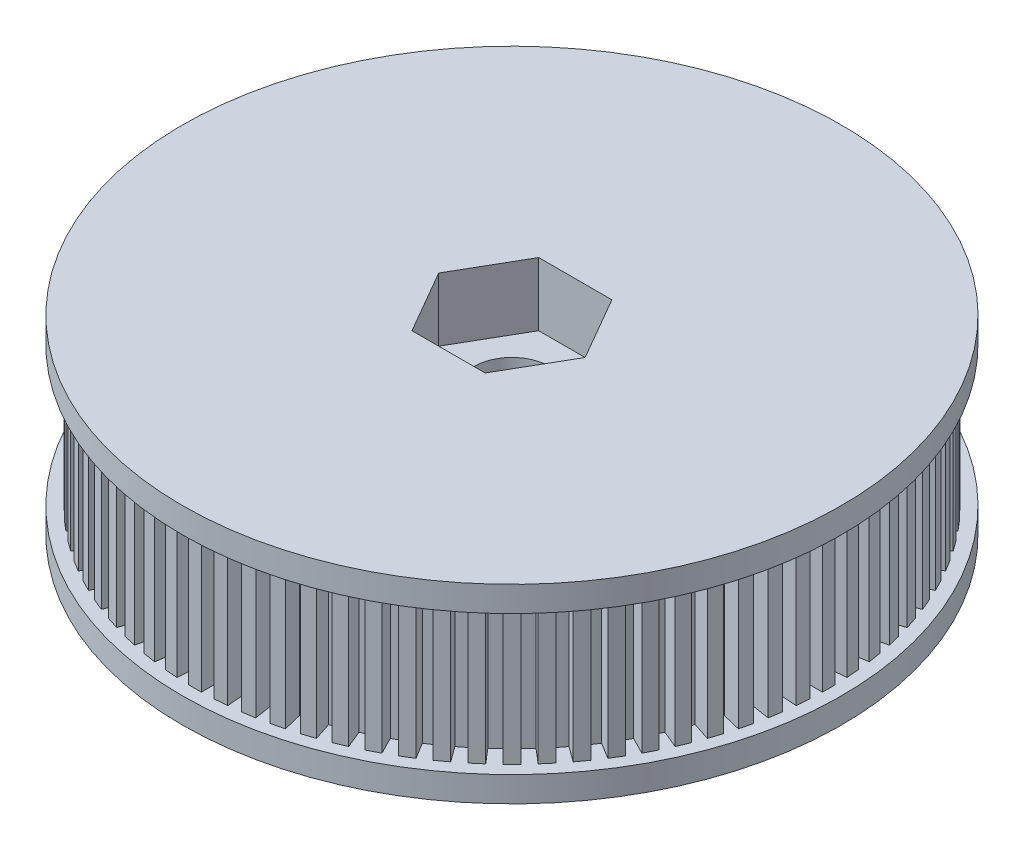
from build123d import *

# Parameters (mm, degrees)
BOSS_EXTRUDE1_OUTLINE_R = 3
BOSS_EXTRUDE1_DEPTH     = 15
SKETCH1_3_R             = 26
SKETCH1_3_R_2           = 23.505318547
SKETCH1_3_R_3           = 3
BOSS_EXTRUDE2_DEPTH     = 2
BOSS_EXTRUDE3_START     = 13
SKETCH1_4_R             = 26
SKETCH1_4_R_2           = 23.505318547
SKETCH1_4_R_3           = 3
BOSS_EXTRUDE3_DEPTH     = 2
CUT_EXTRUDE1_START      = 10
SKETCH1_5_R             = 3
CUT_EXTRUDE1_DEPTH      = 5


with BuildPart() as part:
    # Boss-Extrude1: read off the stored shape, not the designer's step
    # Boss-Extrude1 outline → Boss-Extrude1 (new body)
    with BuildSketch(Plane(origin=(0, 0, 0), x_dir=(1, 0, 0), z_dir=(0, 1, 0))):
        with BuildLine():
            Line((-1.463018726, 24.962162891), (-2.45993606, 24.883703795))
            Line((-2.45993606, 24.883703795), (-2.342247416, 23.388327795))
            ThreePointArc((-2.342247416, 23.388327795), (-2.762753968, 23.34239042), (-3.182365758, 23.288893237))
            Line((-3.182365758, 23.288893237), (-3.417017456, 24.770425747))
            Line((-3.417017456, 24.770425747), (-4.404705796, 24.613991282))
            Line((-4.404705796, 24.613991282), (-4.170054099, 23.132458771))
            ThreePointArc((-4.170054099, 23.132458771), (-4.585660164, 23.053670442), (-4.99978109, 22.967415811))
            Line((-4.99978109, 22.967415811), (-5.349949136, 24.425970692))
            Line((-5.349949136, 24.425970692), (-6.322319057, 24.192525328))
            Line((-6.322319057, 24.192525328), (-5.972151011, 22.733970447))
            ThreePointArc((-5.972151011, 22.733970447), (-6.380294241, 22.62281692), (-6.78637111, 22.50433663))
            Line((-6.78637111, 22.50433663), (-7.249896601, 23.930921405))
            Line((-7.249896601, 23.930921405), (-8.200953118, 23.62190441))
            Line((-8.200953118, 23.62190441), (-7.737427626, 22.195319636))
            ThreePointArc((-7.737427626, 22.195319636), (-8.135591681, 22.052486209), (-8.531120894, 21.90251073))
            Line((-8.531120894, 21.90251073), (-9.105146043, 23.288330029))
            Line((-9.105146043, 23.288330029), (-10.029025575, 22.905646597))
            Line((-10.029025575, 22.905646597), (-9.455000427, 21.519827298))
            ThreePointArc((-9.455000427, 21.519827298), (-9.840730494, 21.346194587), (-10.223273482, 21.165648568))
            Line((-10.223273482, 21.165648568), (-10.904259231, 22.502158355))
            Line((-10.904259231, 22.502158355), (-11.795265756, 22.048167855))
            Line((-11.795265756, 22.048167855), (-11.114280006, 20.711658069))
            ThreePointArc((-11.114280006, 20.711658069), (-11.48519793, 20.508296577), (-11.852396189, 20.298293145))
            Line((-11.852396189, 20.298293145), (-12.636144036, 21.577253391))
            Line((-12.636144036, 21.577253391), (-13.4887842, 21.054754826))
            Line((-13.4887842, 21.054754826), (-12.705036353, 19.77579458))
            ThreePointArc((-12.705036353, 19.77579458), (-13.058855302, 19.543958099), (-13.408444932, 19.305791994))
            Line((-13.408444932, 19.305791994), (-14.29012281, 20.519317486))
            Line((-14.29012281, 20.519317486), (-15.099139804, 19.931532233))
            Line((-15.099139804, 19.931532233), (-14.217461926, 18.718006742))
            ThreePointArc((-14.217461926, 18.718006742), (-14.552000489, 18.459124621), (-14.881826153, 18.194264216))
            Line((-14.881826153, 18.194264216), (-15.855998225, 19.334873164))
            Line((-15.855998225, 19.334873164), (-16.616404191, 18.685425116))
            Line((-16.616404191, 18.685425116), (-15.642232119, 17.544816167))
            ThreePointArc((-15.642232119, 17.544816167), (-15.955427754, 17.260484501), (-16.263455967, 16.970562748))
            Line((-16.263455967, 16.970562748), (-17.324116139, 18.03122292))
            Line((-17.324116139, 18.03122292), (-18.03122292, 17.324116139))
            Line((-18.03122292, 17.324116139), (-16.970562748, 16.263455967))
            ThreePointArc((-16.970562748, 16.263455967), (-17.260484501, 15.955427754), (-17.544816167, 15.642232119))
            Line((-17.544816167, 15.642232119), (-18.685425116, 16.616404191))
            Line((-18.685425116, 16.616404191), (-19.334873164, 15.855998225))
            Line((-19.334873164, 15.855998225), (-18.194264216, 14.881826153))
            ThreePointArc((-18.194264216, 14.881826153), (-18.459124621, 14.552000489), (-18.718006742, 14.217461926))
            Line((-18.718006742, 14.217461926), (-19.931532233, 15.099139804))
            Line((-19.931532233, 15.099139804), (-20.519317486, 14.29012281))
            Line((-20.519317486, 14.29012281), (-19.305791994, 13.408444932))
            ThreePointArc((-19.305791994, 13.408444932), (-19.543958099, 13.058855302), (-19.77579458, 12.705036353))
            Line((-19.77579458, 12.705036353), (-21.054754826, 13.4887842))
            Line((-21.054754826, 13.4887842), (-21.577253391, 12.636144036))
            Line((-21.577253391, 12.636144036), (-20.298293145, 11.852396189))
            ThreePointArc((-20.298293145, 11.852396189), (-20.508296577, 11.48519793), (-20.711658069, 11.114280006))
            Line((-20.711658069, 11.114280006), (-22.048167855, 11.795265756))
            Line((-22.048167855, 11.795265756), (-22.502158355, 10.904259231))
            Line((-22.502158355, 10.904259231), (-21.165648568, 10.223273482))
            ThreePointArc((-21.165648568, 10.223273482), (-21.346194587, 9.840730494), (-21.519827298, 9.455000427))
            Line((-21.519827298, 9.455000427), (-22.905646597, 10.029025575))
            Line((-22.905646597, 10.029025575), (-23.288330029, 9.105146043))
            Line((-23.288330029, 9.105146043), (-21.90251073, 8.531120894))
            ThreePointArc((-21.90251073, 8.531120894), (-22.052486209, 8.135591681), (-22.195319636, 7.737427626))
            Line((-22.195319636, 7.737427626), (-23.62190441, 8.200953118))
            Line((-23.62190441, 8.200953118), (-23.930921405, 7.249896601))
            Line((-23.930921405, 7.249896601), (-22.50433663, 6.78637111))
            ThreePointArc((-22.50433663, 6.78637111), (-22.62281692, 6.380294241), (-22.733970447, 5.972151011))
            Line((-22.733970447, 5.972151011), (-24.192525328, 6.322319057))
            Line((-24.192525328, 6.322319057), (-24.425970692, 5.349949136))
            Line((-24.425970692, 5.349949136), (-22.967415811, 4.99978109))
            ThreePointArc((-22.967415811, 4.99978109), (-23.053670442, 4.585660164), (-23.132458771, 4.170054099))
            Line((-23.132458771, 4.170054099), (-24.613991282, 4.404705796))
            Line((-24.613991282, 4.404705796), (-24.770425747, 3.417017456))
            Line((-24.770425747, 3.417017456), (-23.288893237, 3.182365758))
            ThreePointArc((-23.288893237, 3.182365758), (-23.34239042, 2.762753968), (-23.388327795, 2.342247416))
            Line((-23.388327795, 2.342247416), (-24.883703795, 2.45993606))
            Line((-24.883703795, 2.45993606), (-24.962162891, 1.463018726))
            Line((-24.962162891, 1.463018726), (-23.466786891, 1.345330083))
            ThreePointArc((-23.466786891, 1.345330083), (-23.487196798, 0.922814476), (-23.5, 0.5))
            Line((-23.5, 0.5), (-25, 0.5))
            Line((-25, 0.5), (-25, -0.5))
            Line((-25, -0.5), (-23.5, -0.5))
            ThreePointArc((-23.5, -0.5), (-23.487196798, -0.922814476), (-23.466786891, -1.345330083))
            Line((-23.466786891, -1.345330083), (-24.962162891, -1.463018726))
            Line((-24.962162891, -1.463018726), (-24.883703795, -2.45993606))
            Line((-24.883703795, -2.45993606), (-23.388327795, -2.342247416))
            ThreePointArc((-23.388327795, -2.342247416), (-23.34239042, -2.762753968), (-23.288893237, -3.182365758))
            Line((-23.288893237, -3.182365758), (-24.770425747, -3.417017456))
            Line((-24.770425747, -3.417017456), (-24.613991282, -4.404705796))
            Line((-24.613991282, -4.404705796), (-23.132458771, -4.170054099))
            ThreePointArc((-23.132458771, -4.170054099), (-23.053670442, -4.585660164), (-22.967415811, -4.99978109))
            Line((-22.967415811, -4.99978109), (-24.425970692, -5.349949136))
            Line((-24.425970692, -5.349949136), (-24.192525328, -6.322319057))
            Line((-24.192525328, -6.322319057), (-22.733970447, -5.972151011))
            ThreePointArc((-22.733970447, -5.972151011), (-22.62281692, -6.380294241), (-22.50433663, -6.78637111))
            Line((-22.50433663, -6.78637111), (-23.930921405, -7.249896601))
            Line((-23.930921405, -7.249896601), (-23.62190441, -8.200953118))
            Line((-23.62190441, -8.200953118), (-22.195319636, -7.737427626))
            ThreePointArc((-22.195319636, -7.737427626), (-22.052486209, -8.135591681), (-21.90251073, -8.531120894))
            Line((-21.90251073, -8.531120894), (-23.288330029, -9.105146043))
            Line((-23.288330029, -9.105146043), (-22.905646597, -10.029025575))
            Line((-22.905646597, -10.029025575), (-21.519827298, -9.455000427))
            ThreePointArc((-21.519827298, -9.455000427), (-21.346194587, -9.840730494), (-21.165648568, -10.223273482))
            Line((-21.165648568, -10.223273482), (-22.502158355, -10.904259231))
            Line((-22.502158355, -10.904259231), (-22.048167855, -11.795265756))
            Line((-22.048167855, -11.795265756), (-20.711658069, -11.114280006))
            ThreePointArc((-20.711658069, -11.114280006), (-20.508296577, -11.48519793), (-20.298293145, -11.852396189))
            Line((-20.298293145, -11.852396189), (-21.577253391, -12.636144036))
            Line((-21.577253391, -12.636144036), (-21.054754826, -13.4887842))
            Line((-21.054754826, -13.4887842), (-19.77579458, -12.705036353))
            ThreePointArc((-19.77579458, -12.705036353), (-19.543958099, -13.058855302), (-19.305791994, -13.408444932))
            Line((-19.305791994, -13.408444932), (-20.519317486, -14.29012281))
            Line((-20.519317486, -14.29012281), (-19.931532233, -15.099139804))
            Line((-19.931532233, -15.099139804), (-18.718006742, -14.217461926))
            ThreePointArc((-18.718006742, -14.217461926), (-18.459124621, -14.552000489), (-18.194264216, -14.881826153))
            Line((-18.194264216, -14.881826153), (-19.334873164, -15.855998225))
            Line((-19.334873164, -15.855998225), (-18.685425116, -16.616404191))
            Line((-18.685425116, -16.616404191), (-17.544816167, -15.642232119))
            ThreePointArc((-17.544816167, -15.642232119), (-17.260484501, -15.955427754), (-16.970562748, -16.263455967))
            Line((-16.970562748, -16.263455967), (-18.03122292, -17.324116139))
            Line((-18.03122292, -17.324116139), (-17.324116139, -18.03122292))
            Line((-17.324116139, -18.03122292), (-16.263455967, -16.970562748))
            ThreePointArc((-16.263455967, -16.970562748), (-15.955427754, -17.260484501), (-15.642232119, -17.544816167))
            Line((-15.642232119, -17.544816167), (-16.616404191, -18.685425116))
            Line((-16.616404191, -18.685425116), (-15.855998225, -19.334873164))
            Line((-15.855998225, -19.334873164), (-14.881826153, -18.194264216))
            ThreePointArc((-14.881826153, -18.194264216), (-14.552000489, -18.459124621), (-14.217461926, -18.718006742))
            Line((-14.217461926, -18.718006742), (-15.099139804, -19.931532233))
            Line((-15.099139804, -19.931532233), (-14.29012281, -20.519317486))
            Line((-14.29012281, -20.519317486), (-13.408444932, -19.305791994))
            ThreePointArc((-13.408444932, -19.305791994), (-13.058855302, -19.543958099), (-12.705036353, -19.77579458))
            Line((-12.705036353, -19.77579458), (-13.4887842, -21.054754826))
            Line((-13.4887842, -21.054754826), (-12.636144036, -21.577253391))
            Line((-12.636144036, -21.577253391), (-11.852396189, -20.298293145))
            ThreePointArc((-11.852396189, -20.298293145), (-11.48519793, -20.508296577), (-11.114280006, -20.711658069))
            Line((-11.114280006, -20.711658069), (-11.795265756, -22.048167855))
            Line((-11.795265756, -22.048167855), (-10.904259231, -22.502158355))
            Line((-10.904259231, -22.502158355), (-10.223273482, -21.165648568))
            ThreePointArc((-10.223273482, -21.165648568), (-9.840730494, -21.346194587), (-9.455000427, -21.519827298))
            Line((-9.455000427, -21.519827298), (-10.029025575, -22.905646597))
            Line((-10.029025575, -22.905646597), (-9.105146043, -23.288330029))
            Line((-9.105146043, -23.288330029), (-8.531120894, -21.90251073))
            ThreePointArc((-8.531120894, -21.90251073), (-8.135591681, -22.052486209), (-7.737427626, -22.195319636))
            Line((-7.737427626, -22.195319636), (-8.200953118, -23.62190441))
            Line((-8.200953118, -23.62190441), (-7.249896601, -23.930921405))
            Line((-7.249896601, -23.930921405), (-6.78637111, -22.50433663))
            ThreePointArc((-6.78637111, -22.50433663), (-6.380294241, -22.62281692), (-5.972151011, -22.733970447))
            Line((-5.972151011, -22.733970447), (-6.322319057, -24.192525328))
            Line((-6.322319057, -24.192525328), (-5.349949136, -24.425970692))
            Line((-5.349949136, -24.425970692), (-4.99978109, -22.967415811))
            ThreePointArc((-4.99978109, -22.967415811), (-4.585660164, -23.053670442), (-4.170054099, -23.132458771))
            Line((-4.170054099, -23.132458771), (-4.404705796, -24.613991282))
            Line((-4.404705796, -24.613991282), (-3.417017456, -24.770425747))
            Line((-3.417017456, -24.770425747), (-3.182365758, -23.288893237))
            ThreePointArc((-3.182365758, -23.288893237), (-2.762753968, -23.34239042), (-2.342247416, -23.388327795))
            Line((-2.342247416, -23.388327795), (-2.45993606, -24.883703795))
            Line((-2.45993606, -24.883703795), (-1.463018726, -24.962162891))
            Line((-1.463018726, -24.962162891), (-1.345330083, -23.466786891))
            ThreePointArc((-1.345330083, -23.466786891), (-0.922814476, -23.487196798), (-0.5, -23.5))
            Line((-0.5, -23.5), (-0.5, -25))
            Line((-0.5, -25), (0.5, -25))
            Line((0.5, -25), (0.5, -23.5))
            ThreePointArc((0.5, -23.5), (0.922814476, -23.487196798), (1.345330083, -23.466786891))
            Line((1.345330083, -23.466786891), (1.463018726, -24.962162891))
            Line((1.463018726, -24.962162891), (2.45993606, -24.883703795))
            Line((2.45993606, -24.883703795), (2.342247416, -23.388327795))
            ThreePointArc((2.342247416, -23.388327795), (2.762753968, -23.34239042), (3.182365758, -23.288893237))
            Line((3.182365758, -23.288893237), (3.417017456, -24.770425747))
            Line((3.417017456, -24.770425747), (4.404705796, -24.613991282))
            Line((4.404705796, -24.613991282), (4.170054099, -23.132458771))
            ThreePointArc((4.170054099, -23.132458771), (4.585660164, -23.053670442), (4.99978109, -22.967415811))
            Line((4.99978109, -22.967415811), (5.349949136, -24.425970692))
            Line((5.349949136, -24.425970692), (6.322319057, -24.192525328))
            Line((6.322319057, -24.192525328), (5.972151011, -22.733970447))
            ThreePointArc((5.972151011, -22.733970447), (6.380294241, -22.62281692), (6.78637111, -22.50433663))
            Line((6.78637111, -22.50433663), (7.249896601, -23.930921405))
            Line((7.249896601, -23.930921405), (8.200953118, -23.62190441))
            Line((8.200953118, -23.62190441), (7.737427626, -22.195319636))
            ThreePointArc((7.737427626, -22.195319636), (8.135591681, -22.052486209), (8.531120894, -21.90251073))
            Line((8.531120894, -21.90251073), (9.105146043, -23.288330029))
            Line((9.105146043, -23.288330029), (10.029025575, -22.905646597))
            Line((10.029025575, -22.905646597), (9.455000427, -21.519827298))
            ThreePointArc((9.455000427, -21.519827298), (9.840730494, -21.346194587), (10.223273482, -21.165648568))
            Line((10.223273482, -21.165648568), (10.904259231, -22.502158355))
            Line((10.904259231, -22.502158355), (11.795265756, -22.048167855))
            Line((11.795265756, -22.048167855), (11.114280006, -20.711658069))
            ThreePointArc((11.114280006, -20.711658069), (11.48519793, -20.508296577), (11.852396189, -20.298293145))
            Line((11.852396189, -20.298293145), (12.636144036, -21.577253391))
            Line((12.636144036, -21.577253391), (13.4887842, -21.054754826))
            Line((13.4887842, -21.054754826), (12.705036353, -19.77579458))
            ThreePointArc((12.705036353, -19.77579458), (13.058855302, -19.543958099), (13.408444932, -19.305791994))
            Line((13.408444932, -19.305791994), (14.29012281, -20.519317486))
            Line((14.29012281, -20.519317486), (15.099139804, -19.931532233))
            Line((15.099139804, -19.931532233), (14.217461926, -18.718006742))
            ThreePointArc((14.217461926, -18.718006742), (14.552000489, -18.459124621), (14.881826153, -18.194264216))
            Line((14.881826153, -18.194264216), (15.855998225, -19.334873164))
            Line((15.855998225, -19.334873164), (16.616404191, -18.685425116))
            Line((16.616404191, -18.685425116), (15.642232119, -17.544816167))
            ThreePointArc((15.642232119, -17.544816167), (15.955427754, -17.260484501), (16.263455967, -16.970562748))
            Line((16.263455967, -16.970562748), (17.324116139, -18.03122292))
            Line((17.324116139, -18.03122292), (18.03122292, -17.324116139))
            Line((18.03122292, -17.324116139), (16.970562748, -16.263455967))
            ThreePointArc((16.970562748, -16.263455967), (17.260484501, -15.955427754), (17.544816167, -15.642232119))
            Line((17.544816167, -15.642232119), (18.685425116, -16.616404191))
            Line((18.685425116, -16.616404191), (19.334873164, -15.855998225))
            Line((19.334873164, -15.855998225), (18.194264216, -14.881826153))
            ThreePointArc((18.194264216, -14.881826153), (18.459124621, -14.552000489), (18.718006742, -14.217461926))
            Line((18.718006742, -14.217461926), (19.931532233, -15.099139804))
            Line((19.931532233, -15.099139804), (20.519317486, -14.29012281))
            Line((20.519317486, -14.29012281), (19.305791994, -13.408444932))
            ThreePointArc((19.305791994, -13.408444932), (19.543958099, -13.058855302), (19.77579458, -12.705036353))
            Line((19.77579458, -12.705036353), (21.054754826, -13.4887842))
            Line((21.054754826, -13.4887842), (21.577253391, -12.636144036))
            Line((21.577253391, -12.636144036), (20.298293145, -11.852396189))
            ThreePointArc((20.298293145, -11.852396189), (20.508296577, -11.48519793), (20.711658069, -11.114280006))
            Line((20.711658069, -11.114280006), (22.048167855, -11.795265756))
            Line((22.048167855, -11.795265756), (22.502158355, -10.904259231))
            Line((22.502158355, -10.904259231), (21.165648568, -10.223273482))
            ThreePointArc((21.165648568, -10.223273482), (21.346194587, -9.840730494), (21.519827298, -9.455000427))
            Line((21.519827298, -9.455000427), (22.905646597, -10.029025575))
            Line((22.905646597, -10.029025575), (23.288330029, -9.105146043))
            Line((23.288330029, -9.105146043), (21.90251073, -8.531120894))
            ThreePointArc((21.90251073, -8.531120894), (22.052486209, -8.135591681), (22.195319636, -7.737427626))
            Line((22.195319636, -7.737427626), (23.62190441, -8.200953118))
            Line((23.62190441, -8.200953118), (23.930921405, -7.249896601))
            Line((23.930921405, -7.249896601), (22.50433663, -6.78637111))
            ThreePointArc((22.50433663, -6.78637111), (22.62281692, -6.380294241), (22.733970447, -5.972151011))
            Line((22.733970447, -5.972151011), (24.192525328, -6.322319057))
            Line((24.192525328, -6.322319057), (24.425970692, -5.349949136))
            Line((24.425970692, -5.349949136), (22.967415811, -4.99978109))
            ThreePointArc((22.967415811, -4.99978109), (23.053670442, -4.585660164), (23.132458771, -4.170054099))
            Line((23.132458771, -4.170054099), (24.613991282, -4.404705796))
            Line((24.613991282, -4.404705796), (24.770425747, -3.417017456))
            Line((24.770425747, -3.417017456), (23.288893237, -3.182365758))
            ThreePointArc((23.288893237, -3.182365758), (23.34239042, -2.762753968), (23.388327795, -2.342247416))
            Line((23.388327795, -2.342247416), (24.883703795, -2.45993606))
            Line((24.883703795, -2.45993606), (24.962162891, -1.463018726))
            Line((24.962162891, -1.463018726), (23.466786891, -1.345330083))
            ThreePointArc((23.466786891, -1.345330083), (23.487196798, -0.922814476), (23.5, -0.5))
            Line((23.5, -0.5), (25, -0.5))
            Line((25, -0.5), (25, 0.5))
            Line((25, 0.5), (23.5, 0.5))
            ThreePointArc((23.5, 0.5), (23.487196798, 0.922814476), (23.466786891, 1.345330083))
            Line((23.466786891, 1.345330083), (24.962162891, 1.463018726))
            Line((24.962162891, 1.463018726), (24.883703795, 2.45993606))
            Line((24.883703795, 2.45993606), (23.388327795, 2.342247416))
            ThreePointArc((23.388327795, 2.342247416), (23.34239042, 2.762753968), (23.288893237, 3.182365758))
            Line((23.288893237, 3.182365758), (24.770425747, 3.417017456))
            Line((24.770425747, 3.417017456), (24.613991282, 4.404705796))
            Line((24.613991282, 4.404705796), (23.132458771, 4.170054099))
            ThreePointArc((23.132458771, 4.170054099), (23.053670442, 4.585660164), (22.967415811, 4.99978109))
            Line((22.967415811, 4.99978109), (24.425970692, 5.349949136))
            Line((24.425970692, 5.349949136), (24.192525328, 6.322319057))
            Line((24.192525328, 6.322319057), (22.733970447, 5.972151011))
            ThreePointArc((22.733970447, 5.972151011), (22.62281692, 6.380294241), (22.50433663, 6.78637111))
            Line((22.50433663, 6.78637111), (23.930921405, 7.249896601))
            Line((23.930921405, 7.249896601), (23.62190441, 8.200953118))
            Line((23.62190441, 8.200953118), (22.195319636, 7.737427626))
            ThreePointArc((22.195319636, 7.737427626), (22.052486209, 8.135591681), (21.90251073, 8.531120894))
            Line((21.90251073, 8.531120894), (23.288330029, 9.105146043))
            Line((23.288330029, 9.105146043), (22.905646597, 10.029025575))
            Line((22.905646597, 10.029025575), (21.519827298, 9.455000427))
            ThreePointArc((21.519827298, 9.455000427), (21.346194587, 9.840730494), (21.165648568, 10.223273482))
            Line((21.165648568, 10.223273482), (22.502158355, 10.904259231))
            Line((22.502158355, 10.904259231), (22.048167855, 11.795265756))
            Line((22.048167855, 11.795265756), (20.711658069, 11.114280006))
            ThreePointArc((20.711658069, 11.114280006), (20.508296577, 11.48519793), (20.298293145, 11.852396189))
            Line((20.298293145, 11.852396189), (21.577253391, 12.636144036))
            Line((21.577253391, 12.636144036), (21.054754826, 13.4887842))
            Line((21.054754826, 13.4887842), (19.77579458, 12.705036353))
            ThreePointArc((19.77579458, 12.705036353), (19.543958099, 13.058855302), (19.305791994, 13.408444932))
            Line((19.305791994, 13.408444932), (20.519317486, 14.29012281))
            Line((20.519317486, 14.29012281), (19.931532233, 15.099139804))
            Line((19.931532233, 15.099139804), (18.718006742, 14.217461926))
            ThreePointArc((18.718006742, 14.217461926), (18.459124621, 14.552000489), (18.194264216, 14.881826153))
            Line((18.194264216, 14.881826153), (19.334873164, 15.855998225))
            Line((19.334873164, 15.855998225), (18.685425116, 16.616404191))
            Line((18.685425116, 16.616404191), (17.544816167, 15.642232119))
            ThreePointArc((17.544816167, 15.642232119), (17.260484501, 15.955427754), (16.970562748, 16.263455967))
            Line((16.970562748, 16.263455967), (18.03122292, 17.324116139))
            Line((18.03122292, 17.324116139), (17.324116139, 18.03122292))
            Line((17.324116139, 18.03122292), (16.263455967, 16.970562748))
            ThreePointArc((16.263455967, 16.970562748), (15.955427754, 17.260484501), (15.642232119, 17.544816167))
            Line((15.642232119, 17.544816167), (16.616404191, 18.685425116))
            Line((16.616404191, 18.685425116), (15.855998225, 19.334873164))
            Line((15.855998225, 19.334873164), (14.881826153, 18.194264216))
            ThreePointArc((14.881826153, 18.194264216), (14.552000489, 18.459124621), (14.217461926, 18.718006742))
            Line((14.217461926, 18.718006742), (15.099139804, 19.931532233))
            Line((15.099139804, 19.931532233), (14.29012281, 20.519317486))
            Line((14.29012281, 20.519317486), (13.408444932, 19.305791994))
            ThreePointArc((13.408444932, 19.305791994), (13.058855302, 19.543958099), (12.705036353, 19.77579458))
            Line((12.705036353, 19.77579458), (13.4887842, 21.054754826))
            Line((13.4887842, 21.054754826), (12.636144036, 21.577253391))
            Line((12.636144036, 21.577253391), (11.852396189, 20.298293145))
            ThreePointArc((11.852396189, 20.298293145), (11.48519793, 20.508296577), (11.114280006, 20.711658069))
            Line((11.114280006, 20.711658069), (11.795265756, 22.048167855))
            Line((11.795265756, 22.048167855), (10.904259231, 22.502158355))
            Line((10.904259231, 22.502158355), (10.223273482, 21.165648568))
            ThreePointArc((10.223273482, 21.165648568), (9.840730494, 21.346194587), (9.455000427, 21.519827298))
            Line((9.455000427, 21.519827298), (10.029025575, 22.905646597))
            Line((10.029025575, 22.905646597), (9.105146043, 23.288330029))
            Line((9.105146043, 23.288330029), (8.531120894, 21.90251073))
            ThreePointArc((8.531120894, 21.90251073), (8.135591681, 22.052486209), (7.737427626, 22.195319636))
            Line((7.737427626, 22.195319636), (8.200953118, 23.62190441))
            Line((8.200953118, 23.62190441), (7.249896601, 23.930921405))
            Line((7.249896601, 23.930921405), (6.78637111, 22.50433663))
            ThreePointArc((6.78637111, 22.50433663), (6.380294241, 22.62281692), (5.972151011, 22.733970447))
            Line((5.972151011, 22.733970447), (6.322319057, 24.192525328))
            Line((6.322319057, 24.192525328), (5.349949136, 24.425970692))
            Line((5.349949136, 24.425970692), (4.99978109, 22.967415811))
            ThreePointArc((4.99978109, 22.967415811), (4.585660164, 23.053670442), (4.170054099, 23.132458771))
            Line((4.170054099, 23.132458771), (4.404705796, 24.613991282))
            Line((4.404705796, 24.613991282), (3.417017456, 24.770425747))
            Line((3.417017456, 24.770425747), (3.182365758, 23.288893237))
            ThreePointArc((3.182365758, 23.288893237), (2.762753968, 23.34239042), (2.342247416, 23.388327795))
            Line((2.342247416, 23.388327795), (2.45993606, 24.883703795))
            Line((2.45993606, 24.883703795), (1.463018726, 24.962162891))
            Line((1.463018726, 24.962162891), (1.345330083, 23.466786891))
            ThreePointArc((1.345330083, 23.466786891), (0.922814476, 23.487196798), (0.5, 23.5))
            Line((0.5, 23.5), (0.5, 25))
            Line((0.5, 25), (-0.5, 25))
            Line((-0.5, 25), (-0.5, 23.5))
            ThreePointArc((-0.5, 23.5), (-0.922814476, 23.487196798), (-1.345330083, 23.466786891))
            Line((-1.345330083, 23.466786891), (-1.463018726, 24.962162891))
        make_face()
        Circle(BOSS_EXTRUDE1_OUTLINE_R, mode=Mode.SUBTRACT)
    extrude(amount=BOSS_EXTRUDE1_DEPTH)

    # Sketch1<3> → Boss-Extrude2 (add)
    # profile 1 of 2: a face of its own
    with BuildSketch(Plane(origin=(0, 0, 0), x_dir=(1, 0, 0), z_dir=(0, 1, 0))):
        with Locations(Location((0, 0, 0), (0, 0, 270))):
            Circle(SKETCH1_3_R)
        Circle(SKETCH1_3_R_2, mode=Mode.SUBTRACT)
    # profile 2 of 2: a face of its own
    with BuildSketch(Plane(origin=(0, 0, 0), x_dir=(1, 0, 0), z_dir=(0, 1, 0))):
        Polygon((-2.886751346, 5), (-5.773502692, 0), (-2.886751346, -5), (2.886751346, -5), (5.773502692, 0), (2.886751346, 5), align=None)
        with Locations(Location((0, 0, 0), (0, 0, 270))):
            Circle(SKETCH1_3_R_3, mode=Mode.SUBTRACT)
    extrude(amount=BOSS_EXTRUDE2_DEPTH)

    # Sketch1<4> → Boss-Extrude3 (add)
    # profile 1 of 2: a face of its own
    with BuildSketch(Plane(origin=(0, 0, 0), x_dir=(1, 0, 0), z_dir=(0, 1, 0)).offset(BOSS_EXTRUDE3_START)):
        with Locations(Location((0, 0, 0), (0, 0, 270))):
            Circle(SKETCH1_4_R)
        Circle(SKETCH1_4_R_2, mode=Mode.SUBTRACT)
    # profile 2 of 2: a face of its own
    with BuildSketch(Plane(origin=(0, 0, 0), x_dir=(1, 0, 0), z_dir=(0, 1, 0)).offset(BOSS_EXTRUDE3_START)):
        Polygon((-2.886751346, 5), (-5.773502692, 0), (-2.886751346, -5), (2.886751346, -5), (5.773502692, 0), (2.886751346, 5), align=None)
        with Locations(Location((0, 0, 0), (0, 0, 270))):
            Circle(SKETCH1_4_R_3, mode=Mode.SUBTRACT)
    extrude(amount=BOSS_EXTRUDE3_DEPTH)

    # Sketch1<5> → Cut-Extrude1 (cut)
    with BuildSketch(Plane(origin=(0, 0, 0), x_dir=(1, 0, 0), z_dir=(0, 1, 0)).offset(CUT_EXTRUDE1_START)):
        Polygon((5.773502692, 0), (2.886751346, 5), (-2.886751346, 5), (-5.773502692, 0), (-2.886751346, -5), (2.886751346, -5), align=None)
        with Locations(Location((0, 0, 0), (0, 0, 270))):
            Circle(SKETCH1_5_R, mode=Mode.SUBTRACT)
    extrude(amount=CUT_EXTRUDE1_DEPTH, mode=Mode.SUBTRACT)


solid = part.part
